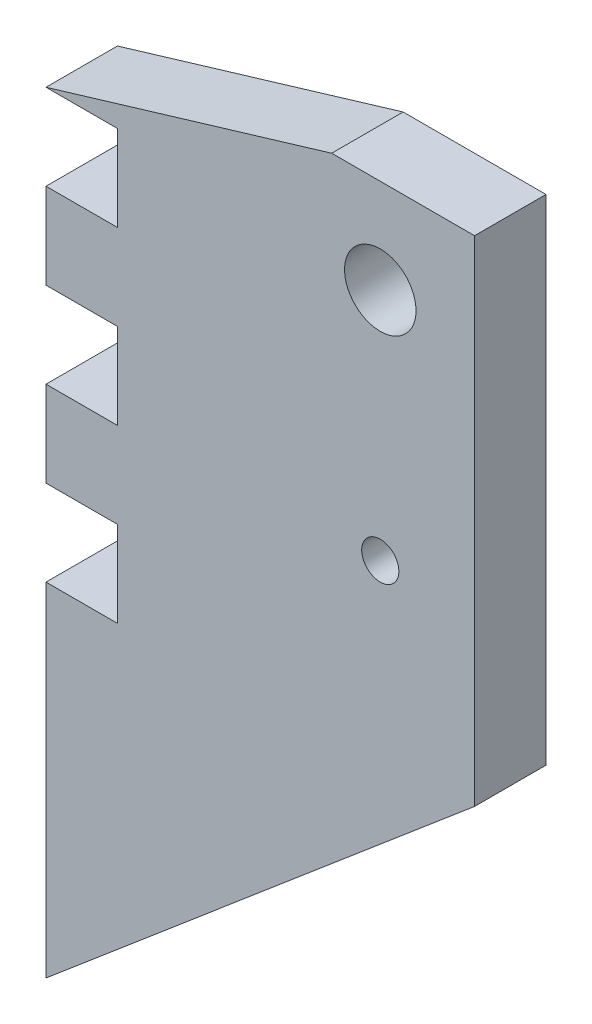
from build123d import *

# Parameters (mm, degrees)
SKETCH1_R           = 1.651
SKETCH1_R_2         = 3.175
BOSS_EXTRUDE1_DEPTH = 6.35
CUT_EXTRUDE1_DEPTH  = 8.636


with BuildPart() as part:
    # Sketch1 → Boss-Extrude1 (new body)
    with BuildSketch(Plane.XY):
        Polygon((0, -43.942), (0, 0), (-38.1, 0), (-38.1, -7.62), (-31.75, -7.62), (-31.75, -15.24), (-38.1, -15.24), (-38.1, -22.86), (-31.75, -22.86), (-31.75, -30.48), (-38.1, -30.48), (-38.1, -38.1), (-31.75, -38.1), (-31.75, -45.72), (-38.1, -45.72), (-38.1, -76.2), align=None)
        with Locations((-8.382, -29.21)):
            Circle(SKETCH1_R, mode=Mode.SUBTRACT)
        with Locations((-8.382, -8.382)):
            Circle(SKETCH1_R_2, mode=Mode.SUBTRACT)
    extrude(amount=BOSS_EXTRUDE1_DEPTH)

    # Sketch2 → Cut-Extrude1 (cut)
    with BuildSketch(Plane(origin=(0, 0, 0), x_dir=(-1, 0, 0), z_dir=(0, 0, -1))):
        Polygon((38.1, 0), (12.7, 0), (38.1, -7.62), align=None)
    extrude(amount=-CUT_EXTRUDE1_DEPTH, mode=Mode.SUBTRACT)


solid = part.part
